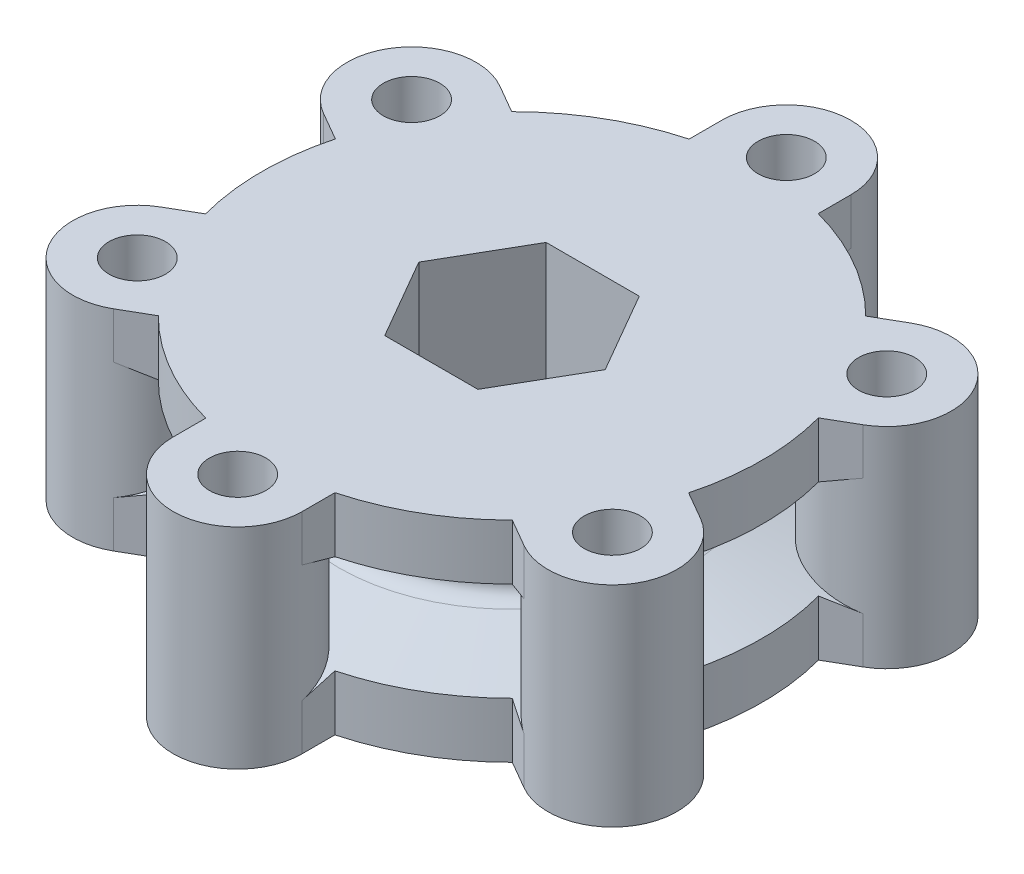
from build123d import *

# Parameters (mm, degrees)
SKETCH1_R           = 31.75
BOSS_EXTRUDE1_DEPTH = 8.255
CUT_EXTRUDE4_DEPTH  = 0.635
CIRPATTERN2_COUNT   = 20
BOSS_EXTRUDE2_REACH = 46.486
SKETCH5_R           = 5.08
SKETCH5_R_2         = 2.2225
BOSS_EXTRUDE6_REACH = 46.486
SKETCH12_R          = 5.08
SKETCH17_R          = 2.2225
CUT_EXTRUDE5_DEPTH  = 43.125921197
CIRPATTERN1_COUNT   = 3
BOSS_EXTRUDE9_REACH = 41.36
SKETCH18_R          = 12.7
FILLET5_R           = 1.27
CUT_EXTRUDE7_DEPTH  = 40.360360407


with BuildPart() as part:
    # Sketch1 → Boss-Extrude1 (new, symmetric)
    with BuildSketch(Plane(origin=(0, 0, 0), x_dir=(1, 0, 0), z_dir=(0, 1, 0))):
        Circle(SKETCH1_R)
    extrude(amount=BOSS_EXTRUDE1_DEPTH, both=True)

    # Sketch9 → Cut-Extrude4 (cut)
    with BuildSketch(Plane.ZY.offset(31.75)):
        Polygon((-0.635, -8.255), (0.635, -8.255), (0.635, 0), (0.635, 8.255), (-0.635, 8.255), (-0.635, 0), align=None)
    cut_extrude4 = extrude(amount=-CUT_EXTRUDE4_DEPTH, mode=Mode.SUBTRACT)

    # CirPattern2: Cut-Extrude4 ×20 about axis
    cirpattern2_axis = Axis((0, -8.255, 0), (0, 1, 0))
    for i in range(1, CIRPATTERN2_COUNT):
        add(cut_extrude4.rotate(cirpattern2_axis, i * 360 / CIRPATTERN2_COUNT), mode=Mode.SUBTRACT)

    # Sketch4 → Cut-Revolve2 (revolve, cut)
    with BuildSketch(Plane.XY):
        Polygon((-31.75, -8.255), (-29.21, -8.255), (-29.21, -6.6675), (-6.35, 0), (-29.21, 6.6675), (-29.21, 8.255), (-31.75, 8.255), align=None)
    revolve(axis=Axis((0, -9.0805, 0), (0, 1, 0)), mode=Mode.SUBTRACT)

    # Sketch5 → Boss-Extrude2 (add, up to next)
    with BuildSketch(Plane(origin=(0, 8.255, 0), x_dir=(1, 0, 0), z_dir=(0, 1, 0)), mode=Mode.PRIVATE) as boss_extrude2_sk1:
        with Locations((0, 21.59)):
            Circle(SKETCH5_R)
        with Locations((0, 21.59)):
            Circle(SKETCH5_R_2, mode=Mode.SUBTRACT)
    boss_extrude2_tool1 = extrude(boss_extrude2_sk1.sketch, amount=-BOSS_EXTRUDE2_REACH, mode=Mode.PRIVATE) - part.part
    boss_extrude2 = boss_extrude2_tool1.solids().sort_by_distance((-4.936316, 8.255, -21.59))[0]
    add(boss_extrude2)

    # Sketch12 → Boss-Extrude6 (add, up to next)
    with BuildSketch(Plane(origin=(0, 8.255, 0), x_dir=(1, 0, 0), z_dir=(0, 1, 0)), mode=Mode.PRIVATE) as boss_extrude6_sk1:
        with Locations((-18.697488468, 10.795)):
            Circle(SKETCH12_R)
    boss_extrude6_tool1 = extrude(boss_extrude6_sk1.sketch, amount=-BOSS_EXTRUDE6_REACH, mode=Mode.PRIVATE) - part.part
    boss_extrude6 = boss_extrude6_tool1.solids().sort_by_distance((-18.697488, 8.255, -10.795))[0]
    add(boss_extrude6)

    # Sketch17 → Cut-Extrude5 (cut, symmetric)
    with BuildSketch(Plane(origin=(0, 0, 0), x_dir=(1, 0, 0), z_dir=(0, 1, 0))):
        with Locations((0, 21.59)):
            Circle(SKETCH17_R)
        with Locations((-18.697488468, 10.795)):
            Circle(SKETCH17_R)
        with Locations((-18.697488468, -10.795)):
            Circle(SKETCH17_R)
        with BuildLine():
            Line((-23.096897519, -13.335), (-25.296602045, -14.605))
            ThreePointArc((-25.296602045, -14.605), (-25.296602045, 14.605), (0, 29.21))
            Line((0, 29.21), (0, 26.67))
            ThreePointArc((0, 26.67), (-3.592102448, 25.182102448), (-5.08, 21.59))
            Line((-5.08, 21.59), (-5.08, 19.018223497))
            ThreePointArc((-5.08, 19.018223497), (-9.8425, 17.047710073), (-13.930264684, 13.9085208))
            Line((-13.930264684, 13.9085208), (-16.157488468, 15.194409051))
            ThreePointArc((-16.157488468, 15.194409051), (-23.096897519, 13.335), (-21.237488468, 6.395590949))
            Line((-21.237488468, 6.395590949), (-19.010264684, 5.109702698))
            ThreePointArc((-19.010264684, 5.109702698), (-19.685, 0), (-19.010264684, -5.109702698))
            Line((-19.010264684, -5.109702698), (-21.237488468, -6.395590949))
            ThreePointArc((-21.237488468, -6.395590949), (-23.604391665, -9.480199251), (-23.096897519, -13.335))
        make_face()
    cut_extrude5 = extrude(amount=CUT_EXTRUDE5_DEPTH, both=True, mode=Mode.SUBTRACT)

    # CirPattern1: Boss-Extrude2, Boss-Extrude6, Cut-Extrude5 ×3 about axis
    cirpattern1_axis = Axis((0, 6.6675, 0), (0, -1, 0))
    add([boss_extrude2.rotate(cirpattern1_axis, i * 360 / CIRPATTERN1_COUNT) for i in range(1, CIRPATTERN1_COUNT)])
    add([boss_extrude6.rotate(cirpattern1_axis, i * 360 / CIRPATTERN1_COUNT) for i in range(1, CIRPATTERN1_COUNT)])
    add([cut_extrude5.rotate(cirpattern1_axis, i * 360 / CIRPATTERN1_COUNT) for i in range(1, CIRPATTERN1_COUNT)], mode=Mode.SUBTRACT)

    # Sketch18 → Boss-Extrude9 (add, up to next)
    with BuildSketch(Plane.XZ.offset(8.255), mode=Mode.PRIVATE) as boss_extrude9_sk1:
        Circle(SKETCH18_R)
    boss_extrude9_tool1 = extrude(boss_extrude9_sk1.sketch, amount=-BOSS_EXTRUDE9_REACH, mode=Mode.PRIVATE) - part.part
    add(boss_extrude9_tool1.solids().sort_by_distance((0, -8.255, 0))[0])

    # Fillet5
    fillet5_edges = [part.edges().sort_by_distance(p)[0] for p in [
        (0, -1.852083333, -12.7),
        (0, 1.852083333, 12.7),
    ]]
    fillet(fillet5_edges, radius=FILLET5_R)

    # Sketch24 → Cut-Extrude7 (cut, through all)
    with BuildSketch(Plane.XZ.offset(8.255)):
        Polygon((3.666174209, -6.35), (7.332348419, 0), (3.666174209, 6.35), (-3.666174209, 6.35), (-7.332348419, 0), (-3.666174209, -6.35), align=None)
    extrude(amount=-CUT_EXTRUDE7_DEPTH, mode=Mode.SUBTRACT)


solid = part.part
